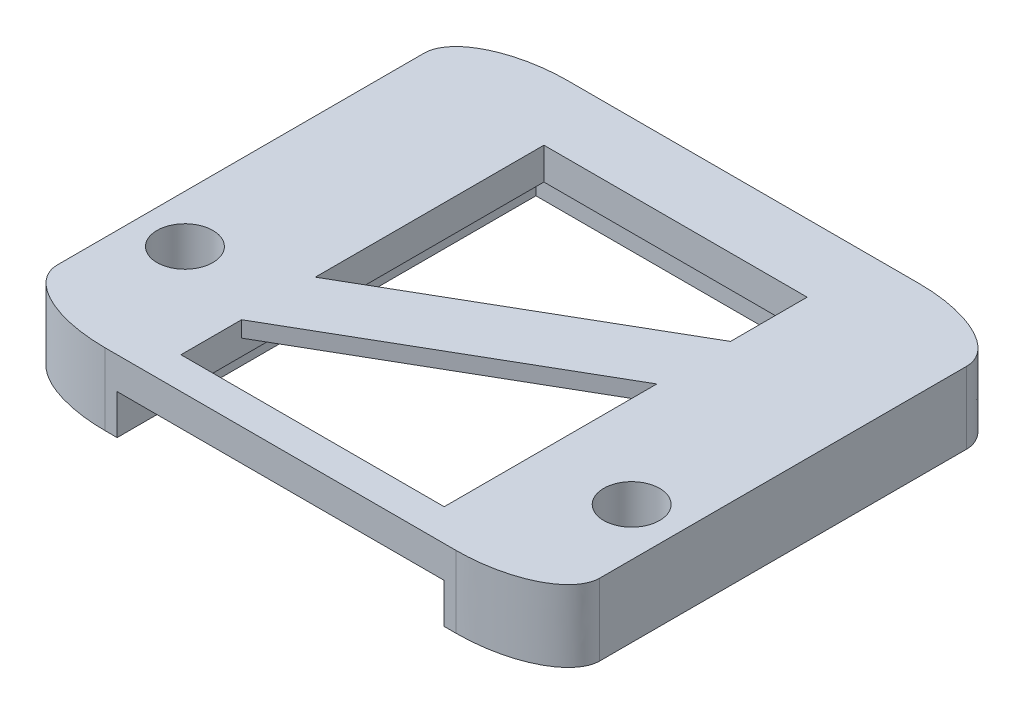
from build123d import *

# Parameters (mm, degrees)
SKETCH1_W           = 34
SKETCH1_H           = 29
BOSS_EXTRUDE1_DEPTH = 2
SKETCH1_4_W         = 6.75
SKETCH1_4_H         = 26.25
BOSS_EXTRUDE2_DEPTH = 2.5
SKETCH2_W           = 34
SKETCH2_H           = 2.75
BOSS_EXTRUDE7_DEPTH = 2.5
CUT_EXTRUDE1_DEPTH  = 23.483327156
SKETCH4_R           = 1.75
CUT_EXTRUDE2_DEPTH  = 23.79254264
SKETCH5_W           = 16.5
SKETCH5_H           = 22.75
CUT_EXTRUDE3_DEPTH  = 1
FILLET1_SIZE        = 6
FILLET1_SIZE_2      = 3


with BuildPart() as part:
    # Sketch1 → Boss-Extrude1 (new body)
    with BuildSketch(Plane(origin=(0, 0, 0), x_dir=(1, 0, 0), z_dir=(0, 1, 0))):
        Rectangle(SKETCH1_W, SKETCH1_H)
    extrude(amount=BOSS_EXTRUDE1_DEPTH)

    # Sketch1<4> → Boss-Extrude2 (add)
    with BuildSketch(Plane(origin=(0, 0, 0), x_dir=(1, 0, 0), z_dir=(0, 1, 0))):
        with Locations((-13.625, -1.375)):
            Rectangle(SKETCH1_4_W, SKETCH1_4_H)
        with Locations((13.625, -1.375)):
            Rectangle(SKETCH1_4_W, SKETCH1_4_H)
    extrude(amount=-BOSS_EXTRUDE2_DEPTH)

    # Sketch2 → Boss-Extrude7 (add)
    with BuildSketch(Plane.XZ):
        with Locations((0, -13.125)):
            Rectangle(SKETCH2_W, SKETCH2_H)
    extrude(amount=BOSS_EXTRUDE7_DEPTH)

    # Sketch3 → Cut-Extrude1 (cut, through all)
    with BuildSketch(Plane.XZ):
        Polygon((-8.25, 12.5), (-8.25, 8.697540798), (8.25, -0.828738644), (8.25, 12.5), align=None)
        Polygon((-8.25, 4.078738644), (-8.25, -10.25), (8.25, -10.25), (8.25, -5.447540798), align=None)
    extrude(amount=-CUT_EXTRUDE1_DEPTH, mode=Mode.SUBTRACT)

    # Sketch4 → Cut-Extrude2 (cut, through all)
    with BuildSketch(Plane.XZ.offset(2.5)):
        with Locations(Location((14, 6.5, 0), (0, 0, 270))):
            Circle(SKETCH4_R)
        with Locations(Location((-14, 6.5, 0), (0, 0, 270))):
            Circle(SKETCH4_R)
    extrude(amount=-CUT_EXTRUDE2_DEPTH, mode=Mode.SUBTRACT)

    # Sketch5 → Cut-Extrude3 (cut)
    with BuildSketch(Plane.XZ):
        with Locations((0, 1.125)):
            Rectangle(SKETCH5_W, SKETCH5_H)
    extrude(amount=-CUT_EXTRUDE3_DEPTH, mode=Mode.SUBTRACT)

    # Fillet1
    # an asymmetric fillet: 6, 3 mm, written as the material it takes off along each edge
    with BuildSketch(Plane(origin=(-17, 17, 14.5), x_dir=(1, 0, 0), z_dir=(0, -1, 0)), Plane(origin=(17, -17.5, 14.5), x_dir=(-1, 0, 0), z_dir=(0, 1, 0))) as fillet1_piece_1:
        with BuildLine():
            Bezier((FILLET1_SIZE, 0), (0, 0), (0, -FILLET1_SIZE_2), weights=[1, 0.707106781, 1])
            Line((0, -FILLET1_SIZE_2), (0, 0))
            Line((0, 0), (FILLET1_SIZE, 0))
        make_face()
    extrude(amount=34.5, mode=Mode.SUBTRACT)
    with BuildSketch(Plane(origin=(-17, 17, -14.5), x_dir=(1, 0, 0), z_dir=(0, -1, 0)), Plane(origin=(17, -17.5, -14.5), x_dir=(-1, 0, 0), z_dir=(0, 1, 0))) as fillet1_piece_2:
        with BuildLine():
            Bezier((FILLET1_SIZE, 0), (0, 0), (0, FILLET1_SIZE_2), weights=[1, 0.707106781, 1])
            Line((0, FILLET1_SIZE_2), (0, 0))
            Line((0, 0), (FILLET1_SIZE, 0))
        make_face()
    extrude(amount=34.5, mode=Mode.SUBTRACT)


solid = part.part
